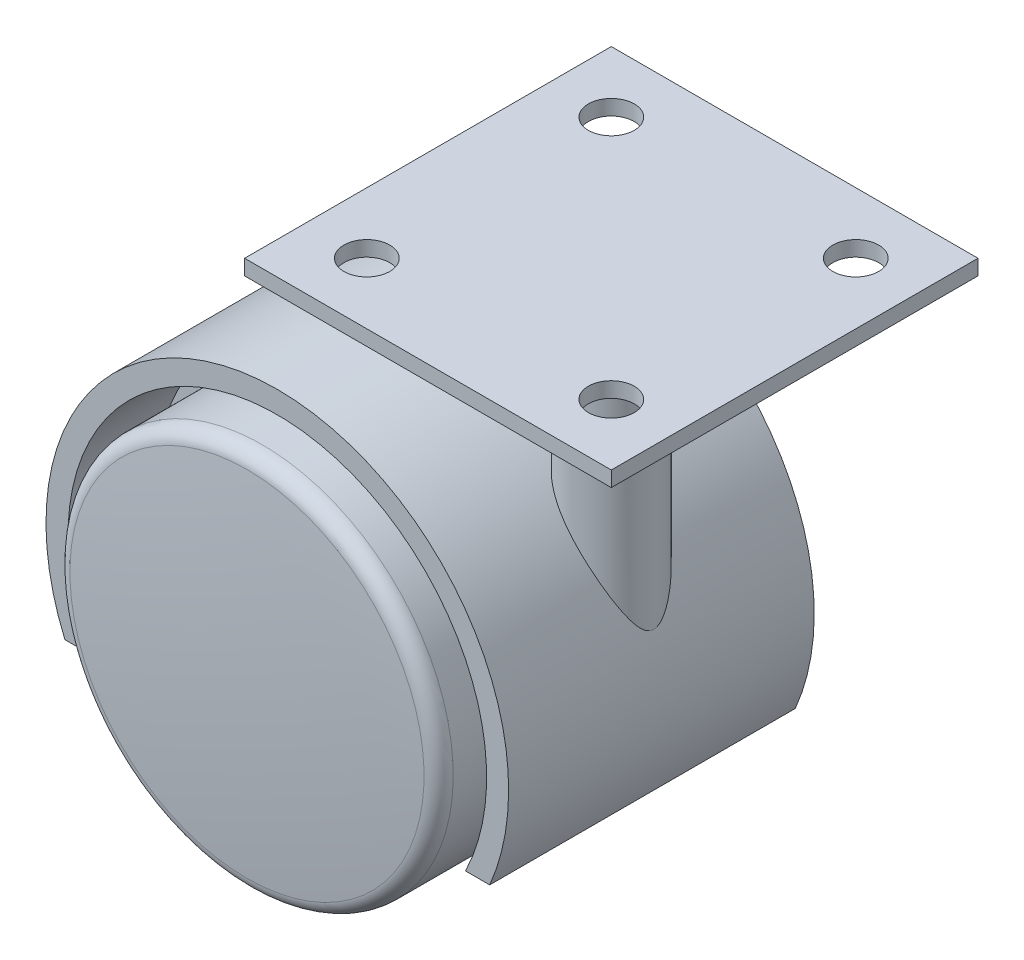
from build123d import *

# Parameters (mm, degrees)
SKETCH16_W          = 38.1
SKETCH16_H          = 1.5875
BOSS_EXTRUDE1_DEPTH = 19.05
SKETCH18_R          = 2.38125
PLATE_2_HOLES_DEPTH = 43.428134549
EXTRUDE1_DEPTH      = 15.875
EXTRUDE7_START      = -20.288251886
EXTRUDE7_DEPTH      = 8.826501886
EXTRUDE2_DEPTH      = 6.731
EXTRUDE2_DEPTH_BACK = 6.731


# Read off the part's stored shape, not the designer's step: Extrude7
with BuildPart() as part:
    # Sketch16 → Boss-Extrude1 (new, symmetric)
    with BuildSketch(Plane.XY):
        with Locations((18.82775, 36.5125)):
            Rectangle(SKETCH16_W, SKETCH16_H)
    extrude(amount=BOSS_EXTRUDE1_DEPTH, both=True)

    # Sketch18 → Plate 2 holes (cut, through all)
    with BuildSketch(Plane(origin=(0, 37.30625, 0), x_dir=(1, 0, 0), z_dir=(0, 1, 0))):
        with Locations(Location((6.12775, 12.7, 0), (0, 0, 270))):
            Circle(SKETCH18_R)
        with Locations(Location((31.52775, 12.7, 0), (0, 0, 90))):
            Circle(SKETCH18_R)
        with Locations(Location((31.52775, -12.7, 0), (0, 0, 270))):
            Circle(SKETCH18_R)
        with Locations(Location((6.12775, -12.7, 0), (0, 0, 90))):
            Circle(SKETCH18_R)
    extrude(amount=-PLATE_2_HOLES_DEPTH, mode=Mode.SUBTRACT)


with BuildPart() as body_2:
    # Sketch2 → Revolve1 (revolve)
    with BuildSketch(Plane(origin=(0, 0, 0), x_dir=(0, 0, -1), z_dir=(1, 0, 0)), mode=Mode.PRIVATE) as revolve1_sk:
        with BuildLine():
            Line((-9.271, 4.7625), (-9.271, 19.84375))
            Line((-9.271, 19.84375), (-17.444092335, 19.84375))
            ThreePointArc((-17.444092335, 19.84375), (-18.51562698, 19.427561126), (-19.025321251, 18.397215832))
            ThreePointArc((-19.025321251, 18.397215832), (-19.639041681, 9.207705686), (-19.84375, 0))
            Line((-19.84375, 0), (0, 0))
            Line((0, 0), (19.84375, 0))
            ThreePointArc((19.84375, 0), (19.639041681, 9.207705686), (19.025321251, 18.397215832))
            ThreePointArc((19.025321251, 18.397215832), (18.51562698, 19.427561126), (17.444092335, 19.84375))
            Line((17.444092335, 19.84375), (9.271, 19.84375))
            Line((9.271, 19.84375), (9.271, 4.7625))
            Line((9.271, 4.7625), (-9.271, 4.7625))
        make_face()
    revolve(revolve1_sk.sketch.rotate(Axis((0, 0, 19.84375), (0, 0, -1)), 180), axis=Axis((0, 0, 19.84375), (0, 0, -1)))


with BuildPart() as body_3:
    # Sketch5 → Extrude1 (new, symmetric)
    with BuildSketch(Plane.XY):
        with BuildLine():
            Line((-22.066798195, -9.525), (-19.552045969, -9.525))
            ThreePointArc((-19.552045969, -9.525), (0, 21.74875), (19.552045969, -9.525))
            Line((19.552045969, -9.525), (22.066798195, -9.525))
            ThreePointArc((22.066798195, -9.525), (0, 24.03475), (-22.066798195, -9.525))
        make_face()
    extrude(amount=EXTRUDE1_DEPTH, both=True)


with BuildPart() as body_4:
    # Sketch7 → Revolve3 (revolve)
    with BuildSketch(Plane.XY, mode=Mode.PRIVATE) as revolve3_sk:
        with BuildLine():
            Line((18.82775, 35.71875), (18.82775, 0))
            Line((18.82775, 0), (23.241, 0))
            Line((23.241, 0), (23.241, 24.03475))
            Line((23.241, 24.03475), (22.89175, 24.03475))
            Line((22.89175, 24.03475), (22.89175, 28.83535))
            Line((22.89175, 28.83535), (23.93315, 28.83535))
            ThreePointArc((23.93315, 28.83535), (24.353218373, 30.81655), (23.93315, 32.79775))
            Line((23.93315, 32.79775), (30.51175, 35.71875))
            Line((30.51175, 35.71875), (18.82775, 35.71875))
        make_face()
    revolve(revolve3_sk.sketch.rotate(Axis((18.82775, -19.84375, 0), (0, 1, 0)), 90), axis=Axis((18.82775, -19.84375, 0), (0, 1, 0)))

    # Extrude7 outline → Extrude7 (cut)
    with BuildSketch(Plane.XY.offset(15.875).offset(EXTRUDE7_START)):
        with BuildLine():
            ThreePointArc((21.74875, 0), (19.830338976, 8.931169166), (14.413543823, 16.286739422))
            Line((14.413543823, 16.286739422), (13, 17.537706562))
            Line((13, 17.537706562), (13, 0))
            Line((13, 0), (21.74875, 0))
        make_face()
    extrude(amount=EXTRUDE7_DEPTH, mode=Mode.SUBTRACT)

    # Sketch8 → Extrude2 (add, two sides: drawn at the far end of the back side and taken through both)
    with BuildSketch(Plane.XY.offset(-EXTRUDE2_DEPTH_BACK)):
        with BuildLine():
            Line((-19.552045969, -9.525), (19.552045969, -9.525))
            ThreePointArc((19.552045969, -9.525), (0, 21.74875), (-19.552045969, -9.525))
        make_face()
    extrude(amount=EXTRUDE2_DEPTH + EXTRUDE2_DEPTH_BACK)

    # Combine1: union body 3, body 2
    add(body_3.part)
    add(body_2.part)


solid = Compound([part.part, body_4.part])
